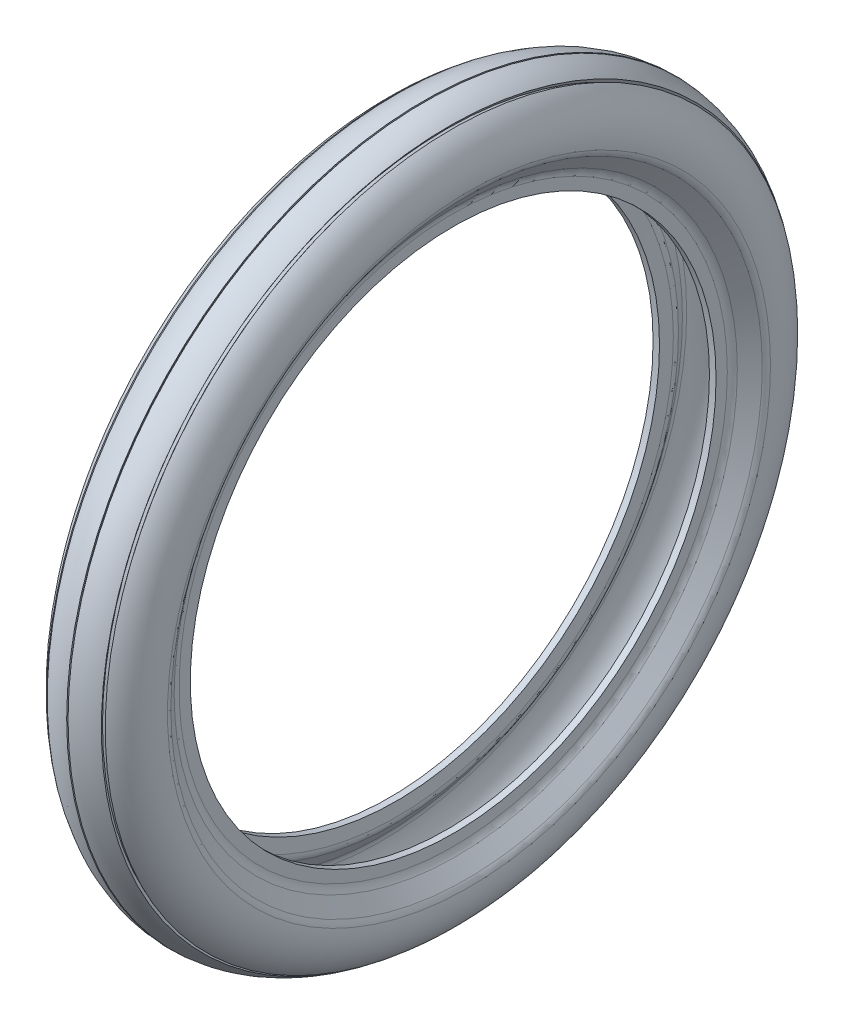
from build123d import *


with BuildPart() as part:
    # Sketch1 → Revolve1 (revolve)
    with BuildSketch(Plane.XY):
        with BuildLine():
            Line((-23.575573263, 207.417047064), (-18.167331744, 207.284603806))
            Line((-18.167331744, 207.284603806), (-17.896296919, 218.352149347))
            ThreePointArc((-17.896296919, 218.352149347), (-18.351253955, 221.588516168), (-19.825402249, 224.505353996))
            Line((-19.825402249, 224.505353996), (-28.615892665, 236.50876218))
            ThreePointArc((-28.615892665, 236.50876218), (-29.965625636, 239.054376361), (-30.533513462, 241.879165569))
            ThreePointArc((-30.533513462, 241.879165569), (-21.306788672, 267.313631414), (3.407461141, 278.325005506))
            ThreePointArc((3.407461141, 278.325005506), (27.844725076, 266.711882129), (36.446002531, 241.059152658))
            ThreePointArc((36.446002531, 241.059152658), (35.809128951, 238.249113033), (34.397479275, 235.737305746))
            Line((34.397479275, 235.737305746), (25.31575838, 223.952702428))
            ThreePointArc((25.31575838, 223.952702428), (23.770642444, 221.072828672), (23.236589639, 217.848570043))
            Line((23.236589639, 217.848570043), (23.236589639, 206.777706292))
            Line((23.236589639, 206.777706292), (28.646452627, 206.777706292))
            Line((28.646452627, 206.777706292), (28.646452627, 216.005880975))
            ThreePointArc((28.646452627, 216.005880975), (29.180505432, 219.230139604), (30.725621368, 222.110013359))
            Line((30.725621368, 222.110013359), (39.612199271, 233.641395644))
            ThreePointArc((39.612199271, 233.641395644), (40.919462944, 235.89296214), (41.601201125, 238.40567443))
            ThreePointArc((41.601201125, 238.40567443), (39.129827768, 258.548282548), (27.091599493, 274.885767302))
            Line((27.091599493, 274.885767302), (24.915141056, 272.05532835))
            Line((24.915141056, 272.05532835), (23.231892573, 273.310985368))
            Line((23.231892573, 273.310985368), (25.276037059, 276.268158718))
            ThreePointArc((25.276037059, 276.268158718), (15.815793164, 281.289331339), (5.362323418, 283.620288079))
            Line((5.362323418, 283.620288079), (3.445619589, 281.441827668))
            Line((3.445619589, 281.441827668), (4.362323418, 283.738474169))
            ThreePointArc((4.362323418, 283.738474169), (-7.601200879, 282.018778625), (-18.50491557, 276.804157611))
            Line((-18.50491557, 276.804157611), (-16.533780732, 273.797826234))
            Line((-16.533780732, 273.797826234), (-18.247265464, 272.583754543))
            Line((-18.247265464, 272.583754543), (-20.353777285, 275.466628793))
            ThreePointArc((-20.353777285, 275.466628793), (-32.788368668, 259.428758448), (-35.752128877, 239.352691266))
            ThreePointArc((-35.752128877, 239.352691266), (-35.132110784, 236.82404191), (-33.880361362, 234.541146078))
            Line((-33.880361362, 234.541146078), (-25.278756139, 222.795660485))
            ThreePointArc((-25.278756139, 222.795660485), (-23.804607845, 219.878822657), (-23.349650808, 216.642455837))
            Line((-23.349650808, 216.642455837), (-23.575573263, 207.417047064))
        make_face()
    revolve(axis=Axis((48.036616421, -8.5, 0), (-1, 0, 0)))


solid = part.part
